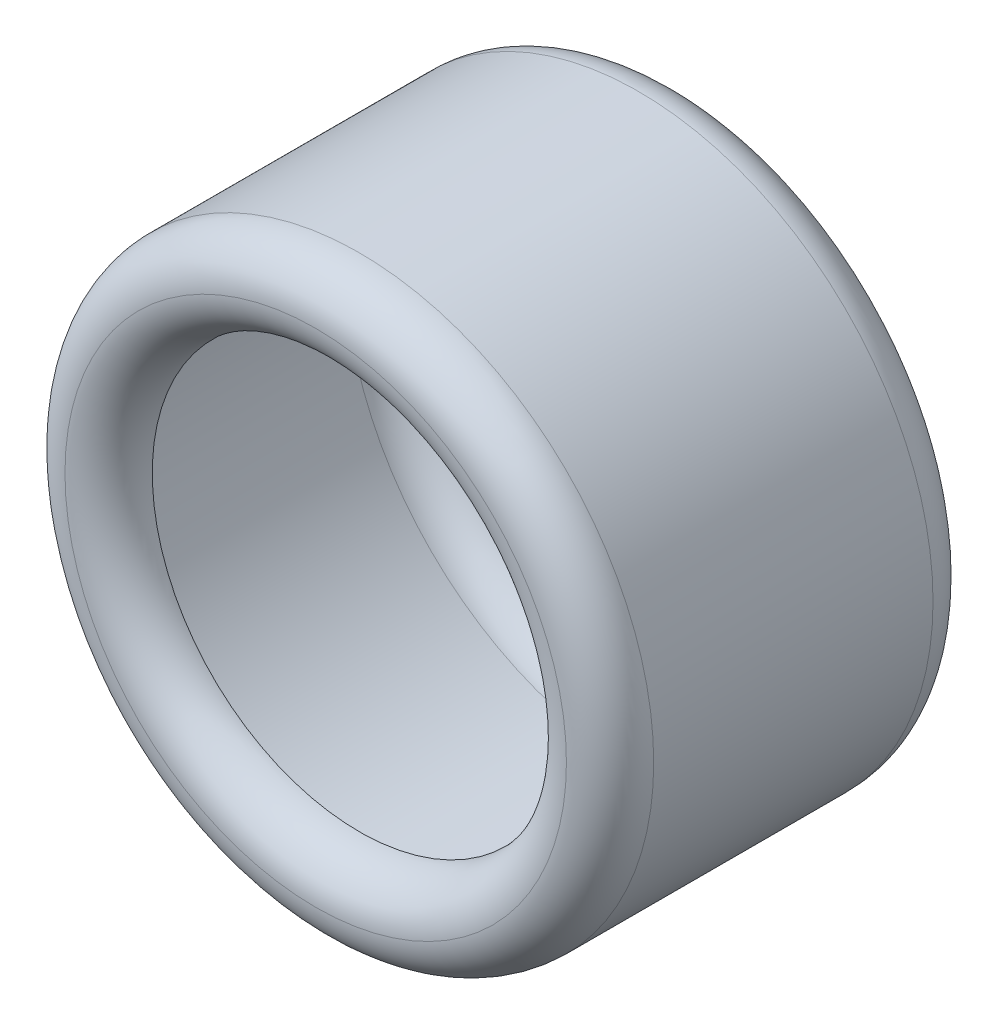
from build123d import *

# Parameters (mm, degrees)
SKETCH1_R           = 85.664088456
SKETCH1_R_2         = 60.264088456
EXTRUDE_THIN3_DEPTH = 106.68
FILLET7_R           = 12.7
FILLET8_R           = 12.7


# Read off the part's stored shape, not the designer's step: Shell1
with BuildPart() as part:
    # Sketch1 → Extrude-Thin3 (new body)
    with BuildSketch(Plane.XY):
        Circle(SKETCH1_R)
        Circle(SKETCH1_R_2, mode=Mode.SUBTRACT)
    extrude(amount=EXTRUDE_THIN3_DEPTH)

    # Fillet7
    fillet7_edges = [part.edges().sort_by_distance(p)[0] for p in [
        (-85.664088456, 0, 0),
        (-85.664088456, 0, 106.68),
    ]]
    fillet(fillet7_edges, radius=FILLET7_R)

    # Fillet8
    fillet8_edges = [part.edges().sort_by_distance(p)[0] for p in [
        (-60.264088456, 0, 0),
        (-60.264088456, 0, 106.68),
    ]]
    fillet(fillet8_edges, radius=FILLET8_R - 0.0001)  # a hair under: the kernel refuses the full size

    # Shell1 outline → Shell1 (revolve, cut)
    with BuildSketch(Plane.XZ):
        with BuildLine():
            Line((60.264088456, 93.98), (60.264088456, 12.7))
            Line((60.264088456, 12.7), (60.518088456, 12.7))
            ThreePointArc((60.518088456, 12.7), (64.163437457, 3.899349001), (72.964088456, 0.254))
            ThreePointArc((72.964088456, 0.254), (81.764739454, 3.899349001), (85.410088456, 12.7))
            Line((85.410088456, 12.7), (85.410088456, 93.98))
            ThreePointArc((85.410088456, 93.98), (81.764739454, 102.780650998), (72.964088456, 106.426))
            ThreePointArc((72.964088456, 106.426), (64.163437457, 102.780650999), (60.518088456, 93.98))
            Line((60.518088456, 93.98), (60.264088456, 93.98))
        make_face()
    revolve(axis=Axis((0, 0, 0), (0, 0, 1)), mode=Mode.SUBTRACT)


solid = part.part
